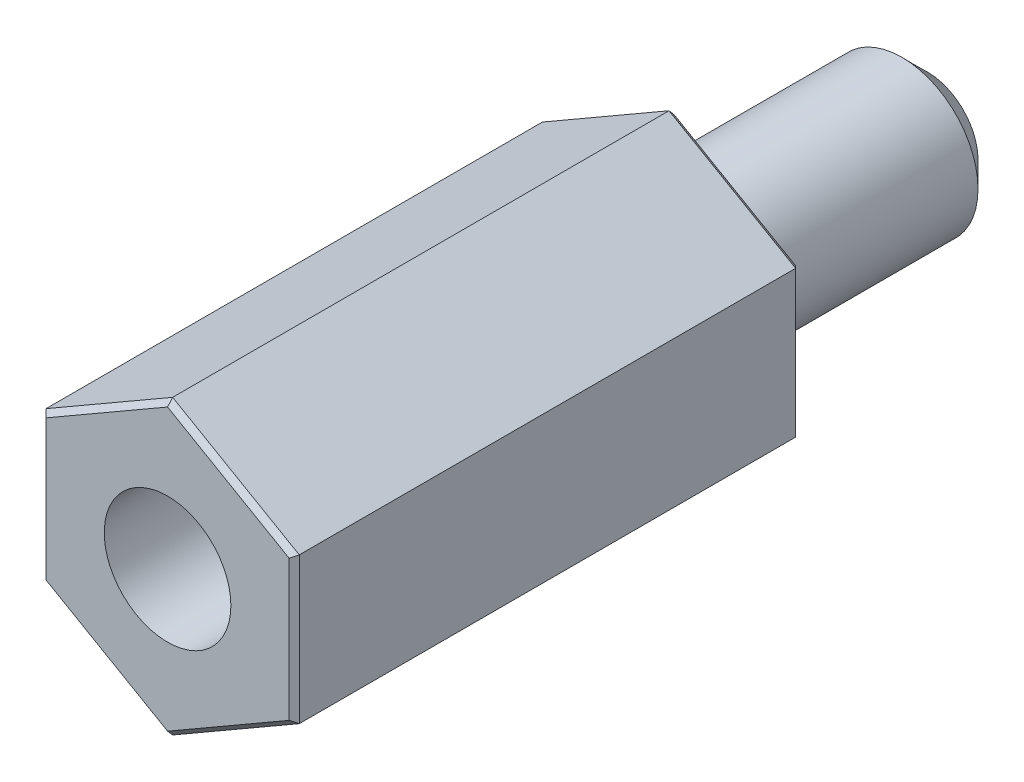
from build123d import *

# Parameters (mm, degrees)
DODANIE_WYCI_GNI_CIE1_DEPTH = 10
SZKIC2_R                    = 1.5
DODANIE_WYCI_GNI_CIE2_DEPTH = 5
SFAZOWANIE2_SIZE            = 0.5
OTW_R_GWINTOWANY_M31_D      = 2.5
OTW_R_GWINTOWANY_M31_DEPTH  = 8
OTW_R_GWINTOWANY_M31_TIP    = 0.751075774
SFAZOWANIE3_SIZE            = 0.1


with BuildPart() as part:
    # Szkic1 → Dodanie-wyciągnięcie1 (new body)
    with BuildSketch(Plane.XY):
        Polygon((0, 2.886751346), (-2.5, 1.443375673), (-2.5, -1.443375673), (0, -2.886751346), (2.5, -1.443375673), (2.5, 1.443375673), align=None)
    extrude(amount=DODANIE_WYCI_GNI_CIE1_DEPTH)

    # Szkic2 → Dodanie-wyciągnięcie2 (add)
    with BuildSketch(Plane(origin=(0, 0, 0), x_dir=(-1, 0, 0), z_dir=(0, 0, -1))):
        Circle(SZKIC2_R)
    extrude(amount=DODANIE_WYCI_GNI_CIE2_DEPTH)

    # Sfazowanie2
    sfazowanie2_edges = [part.edges().sort_by_distance(p)[0] for p in [
        (1.5, 0, -5),
    ]]
    chamfer(sfazowanie2_edges, length=SFAZOWANIE2_SIZE)

    # Otwór gwintowany M31
    with Locations(Plane.XY.offset(10)):
        with Locations((0, 0)):
            Hole(OTW_R_GWINTOWANY_M31_D / 2, depth=OTW_R_GWINTOWANY_M31_DEPTH)
            with Locations((0, 0, -(OTW_R_GWINTOWANY_M31_DEPTH + OTW_R_GWINTOWANY_M31_TIP / 2))):  # 118° drill point
                Cone(0, OTW_R_GWINTOWANY_M31_D / 2, OTW_R_GWINTOWANY_M31_TIP, mode=Mode.SUBTRACT)

    # Sfazowanie3
    sfazowanie3_edges = [part.edges().sort_by_distance(p)[0] for p in [
        (2.5, 0, 10),
        (1.25, -2.165063509, 10),
        (-1.25, -2.165063509, 10),
        (-2.5, 0, 10),
        (-1.25, 2.165063509, 10),
        (1.25, 2.165063509, 10),
        (1.25, -2.165063509, 0),
        (2.5, 0, 0),
        (1.25, 2.165063509, 0),
        (-1.25, 2.165063509, 0),
        (-1.25, -2.165063509, 0),
        (-2.5, 0, 0),
    ]]
    chamfer(sfazowanie3_edges, length=SFAZOWANIE3_SIZE)


solid = part.part
